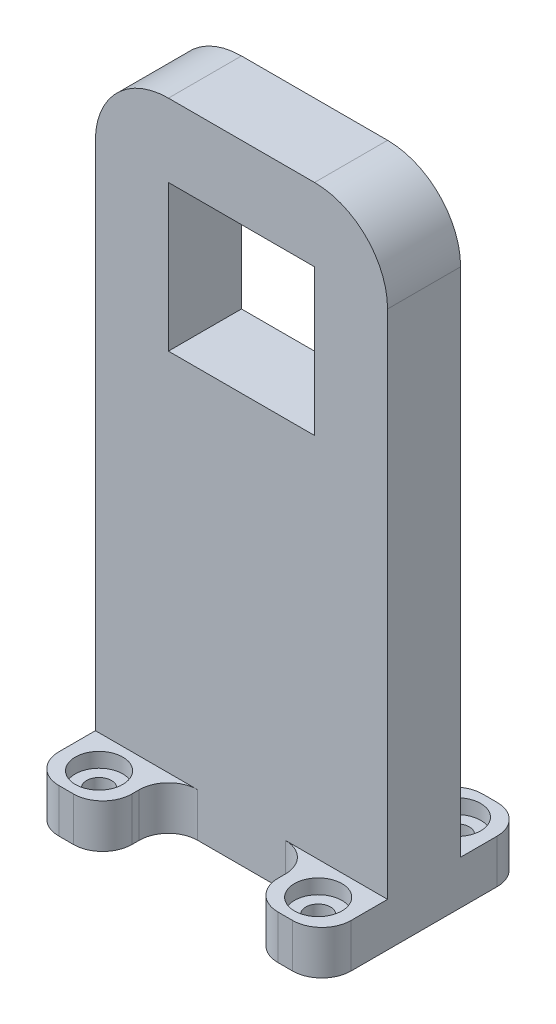
from build123d import *

# Parameters (mm, degrees)
ESQUISSE1_W                                          = 40
ESQUISSE1_H                                          = 86
ESQUISSE1_W_2                                        = 20
ESQUISSE1_H_2                                        = 20
BOSS_EXTRU_1_DEPTH                                   = 10
ESQUISSE3_W                                          = 10
ESQUISSE3_H                                          = 6
BOSS_EXTRU_2_DEPTH                                   = 9
CHAMBRAGE_POUR_T_TE_CYLINDRIQUE_FENDUE_M_D           = 3.4
CHAMBRAGE_POUR_T_TE_CYLINDRIQUE_FENDUE_M_CBORE_D     = 6.5
CHAMBRAGE_POUR_T_TE_CYLINDRIQUE_FENDUE_M_CBORE_DEPTH = 2
CONG_1_R                                             = 4
CONG_2_R                                             = 10


with BuildPart() as part:
    # Esquisse1 → Boss.-Extru.1 (new body)
    with BuildSketch(Plane.XY):
        with Locations((20, 43)):
            Rectangle(ESQUISSE1_W, ESQUISSE1_H)
        with Locations((20, 66)):
            Rectangle(ESQUISSE1_W_2, ESQUISSE1_H_2, mode=Mode.SUBTRACT)
    extrude(amount=BOSS_EXTRU_1_DEPTH)

    # Esquisse3 → Boss.-Extru.2 (add)
    with BuildSketch(Plane.XY.offset(10)):
        with Locations((35, 3)):
            Rectangle(ESQUISSE3_W, ESQUISSE3_H)
        with Locations((5, 3)):
            Rectangle(ESQUISSE3_W, ESQUISSE3_H)
    boss_extru_2 = extrude(amount=BOSS_EXTRU_2_DEPTH)

    # Chambrage pour tête cylindrique fendue M31 (through all)
    with Locations(Plane(origin=(0, 6, 0), x_dir=(1, 0, 0), z_dir=(0, 1, 0))):
        with Locations((5, -14.5), (35, -14.5)):
            chambrage_pour_t_te_cylindrique_fendue_m = CounterBoreHole(CHAMBRAGE_POUR_T_TE_CYLINDRIQUE_FENDUE_M_D / 2, CHAMBRAGE_POUR_T_TE_CYLINDRIQUE_FENDUE_M_CBORE_D / 2, CHAMBRAGE_POUR_T_TE_CYLINDRIQUE_FENDUE_M_CBORE_DEPTH)

    # Symétrie1: Boss.-Extru.2, Chambrage pour tête cylindrique fendue M31 across plane
    add(boss_extru_2.mirror(Plane.XY.offset(5)))
    add(chambrage_pour_t_te_cylindrique_fendue_m.mirror(Plane.XY.offset(5)), mode=Mode.SUBTRACT)

    # Congé1
    cong_1_edges = [part.edges().sort_by_distance(p)[0] for p in [
        (40, 3, 19),
        (30, 3, 19),
        (0, 3, 19),
        (10, 3, 19),
        (30, 3, 10),
        (10, 3, 10),
        (0, 3, -9),
        (10, 3, -9),
        (10, 3, 0),
        (30, 3, 0),
        (30, 3, -9),
        (40, 3, -9),
    ]]
    fillet(cong_1_edges, radius=CONG_1_R)

    # Congé2
    cong_2_edges = [part.edges().sort_by_distance(p)[0] for p in [
        (0, 86, 5),
        (40, 86, 5),
    ]]
    fillet(cong_2_edges, radius=CONG_2_R)


solid = part.part
